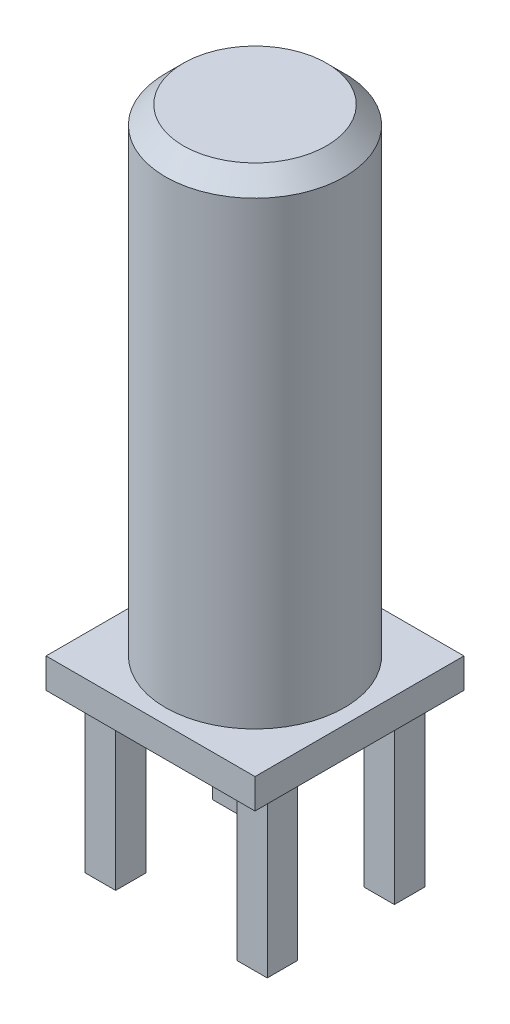
from build123d import *

# Parameters (mm, degrees)
SKETCH1_W           = 7
SKETCH1_H           = 7
BOSS_EXTRUDE1_DEPTH = 1
SKETCH2_W           = 1.02
SKETCH2_H           = 1.02
BOSS_EXTRUDE2_DEPTH = 5.5
SKETCH4_R           = 3
BOSS_EXTRUDE3_DEPTH = 16
CHAMFER1_SIZE       = 0.6


with BuildPart() as part:
    # Sketch1 → Boss-Extrude1 (new body)
    with BuildSketch(Plane(origin=(0, 0, 0), x_dir=(1, 0, 0), z_dir=(0, 1, 0))):
        Rectangle(SKETCH1_W, SKETCH1_H)
    extrude(amount=BOSS_EXTRUDE1_DEPTH)

    # Sketch2 → Boss-Extrude2 (add)
    with BuildSketch(Plane.XZ):
        with Locations((-2.54, 2.129508614)):
            Rectangle(SKETCH2_W, SKETCH2_H)
        with Locations((-2.54, -2.129508614)):
            Rectangle(SKETCH2_W, SKETCH2_H)
        with Locations((2.54, 2.129508614)):
            Rectangle(SKETCH2_W, SKETCH2_H)
        with Locations((2.54, -2.129508614)):
            Rectangle(SKETCH2_W, SKETCH2_H)
    extrude(amount=BOSS_EXTRUDE2_DEPTH)

    # Sketch4 → Boss-Extrude3 (add)
    with BuildSketch(Plane(origin=(0, 1, 0), x_dir=(1, 0, 0), z_dir=(0, 1, 0))):
        Circle(SKETCH4_R)
    extrude(amount=BOSS_EXTRUDE3_DEPTH)

    # Chamfer1
    chamfer1_edges = [part.edges().sort_by_distance(p)[0] for p in [
        (-3, 17, 0),
    ]]
    chamfer(chamfer1_edges, length=CHAMFER1_SIZE)


solid = part.part
